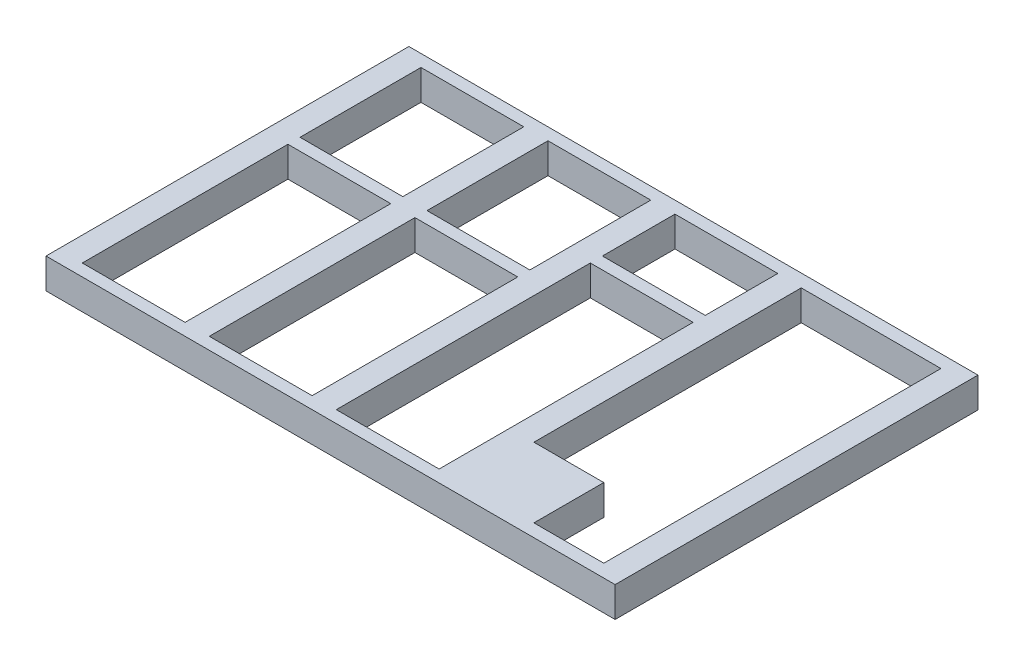
from build123d import *

# Parameters (mm, degrees)
SKETCH1_W           = 94.1
SKETCH1_H           = 60
SKETCH1_W_2         = 17
SKETCH1_H_2         = 34
SKETCH1_H_3         = 20
SKETCH1_H_4         = 42
SKETCH1_H_5         = 12
BOSS_EXTRUDE1_DEPTH = 5


with BuildPart() as part:
    # Sketch1 → Boss-Extrude1 (new body)
    with BuildSketch(Plane(origin=(0, 0, 0), x_dir=(1, 0, 0), z_dir=(0, 1, 0))):
        Rectangle(SKETCH1_W, SKETCH1_H)
        Polygon((19.95, 27.875), (43.05, 27.875), (43.05, -27.875), (31.5, -27.875), (31.5, -16.325), (19.95, -16.325), align=None, mode=Mode.SUBTRACT)
        with Locations((-34.55, -11)):
            Rectangle(SKETCH1_W_2, SKETCH1_H_2, mode=Mode.SUBTRACT)
        with Locations((-34.55, 18)):
            Rectangle(SKETCH1_W_2, SKETCH1_H_3, mode=Mode.SUBTRACT)
        with Locations((-13.55, -11)):
            Rectangle(SKETCH1_W_2, SKETCH1_H_2, mode=Mode.SUBTRACT)
        with Locations((-13.55, 18)):
            Rectangle(SKETCH1_W_2, SKETCH1_H_3, mode=Mode.SUBTRACT)
        with Locations((7.45, -7)):
            Rectangle(SKETCH1_W_2, SKETCH1_H_4, mode=Mode.SUBTRACT)
        with Locations((7.45, 22)):
            Rectangle(SKETCH1_W_2, SKETCH1_H_5, mode=Mode.SUBTRACT)
    extrude(amount=BOSS_EXTRUDE1_DEPTH)


solid = part.part
